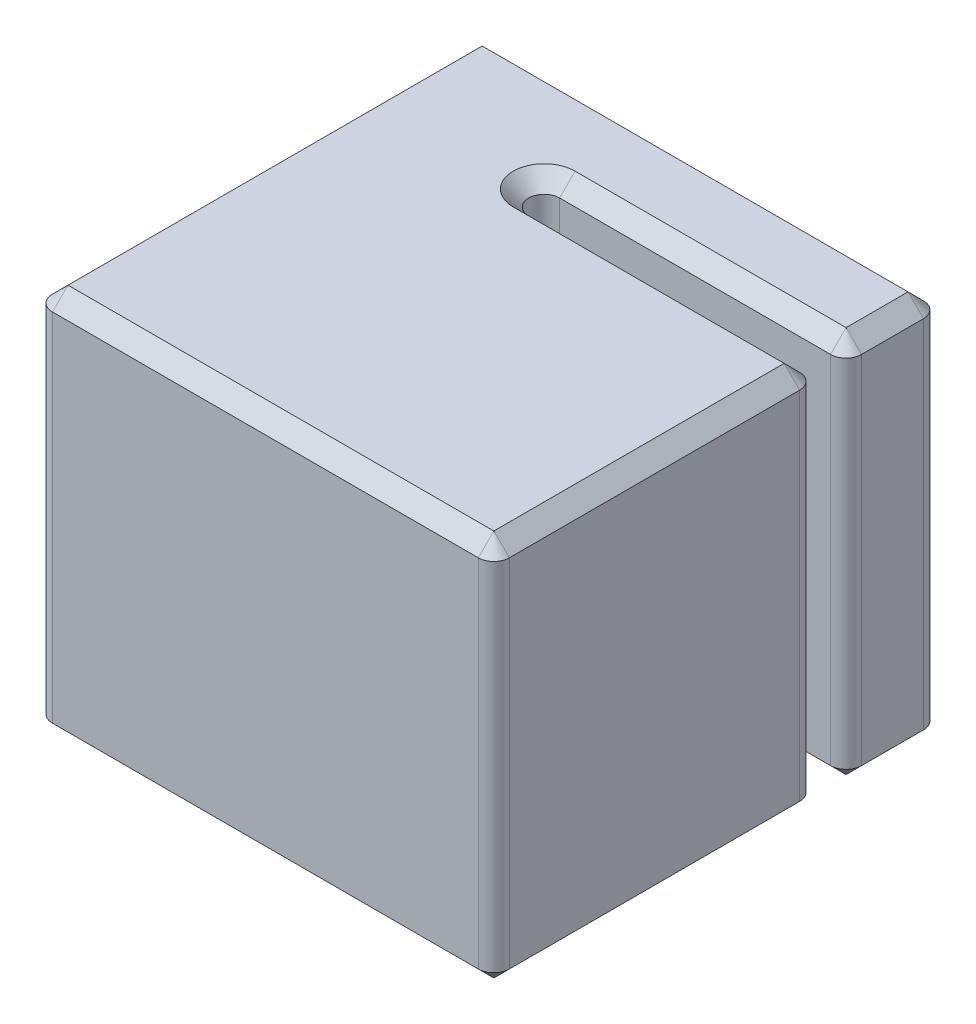
from build123d import *

# Parameters (mm, degrees)
BOSS_EXTRUDE1_DEPTH = 10
CHAMFER1_SIZE       = 0.4


with BuildPart() as part:
    # Sketch1 → Boss-Extrude1 (new body)
    with BuildSketch(Plane(origin=(0, 0, 0), x_dir=(1, 0, 0), z_dir=(0, 1, 0))):
        with BuildLine():
            Line((0, 0.4), (7, 0.4))
            ThreePointArc((7, 0.4), (7.282842712, 0.517157288), (7.4, 0.8))
            Line((7.4, 0.8), (7.4, 2.4))
            ThreePointArc((7.4, 2.4), (7.282842712, 2.682842712), (7, 2.8))
            Line((7, 2.8), (-4, 2.8))
            ThreePointArc((-4, 2.8), (-4.282842712, 2.682842712), (-4.4, 2.4))
            Line((-4.4, 2.4), (-4.4, -8.3))
            ThreePointArc((-4.4, -8.3), (-4.282842712, -8.582842712), (-4, -8.7))
            Line((-4, -8.7), (7, -8.7))
            ThreePointArc((7, -8.7), (7.282842712, -8.582842712), (7.4, -8.3))
            Line((7.4, -8.3), (7.4, -0.8))
            ThreePointArc((7.4, -0.8), (7.282842712, -0.517157288), (7, -0.4))
            Line((7, -0.4), (0, -0.4))
            ThreePointArc((0, -0.4), (-0.4, 0), (0, 0.4))
        make_face()
    extrude(amount=BOSS_EXTRUDE1_DEPTH)

    # Chamfer1
    chamfer1_edges = [part.edges().sort_by_distance(p)[0] for p in [
        (7.282842712, 10, -0.517157288),
        (3.5, 0, 0.4),
        (7.282842712, 0, 0.517157288),
        (7.4, 0, 4.55),
        (7.282842712, 0, 8.582842712),
        (1.5, 0, 8.7),
        (-4.282842712, 0, 8.582842712),
        (-4.4, 0, 2.95),
        (-4.282842712, 0, -2.682842712),
        (7.4, 10, -1.6),
        (1.5, 0, -2.8),
        (7.282842712, 0, -2.682842712),
        (7.4, 0, -1.6),
        (7.282842712, 0, -0.517157288),
        (3.5, 0, -0.4),
        (-0.4, 0, 0),
        (7.282842712, 10, -2.682842712),
        (1.5, 10, -2.8),
        (-4.282842712, 10, -2.682842712),
        (-4.4, 10, 2.95),
        (-4.282842712, 10, 8.582842712),
        (1.5, 10, 8.7),
        (7.282842712, 10, 8.582842712),
        (7.4, 10, 4.55),
        (-0.4, 10, 0),
        (7.282842712, 10, 0.517157288),
        (3.5, 10, 0.4),
        (3.5, 10, -0.4),
    ]]
    chamfer(chamfer1_edges, length=CHAMFER1_SIZE - 0.0001)  # a hair under: the kernel refuses the full size


solid = part.part
